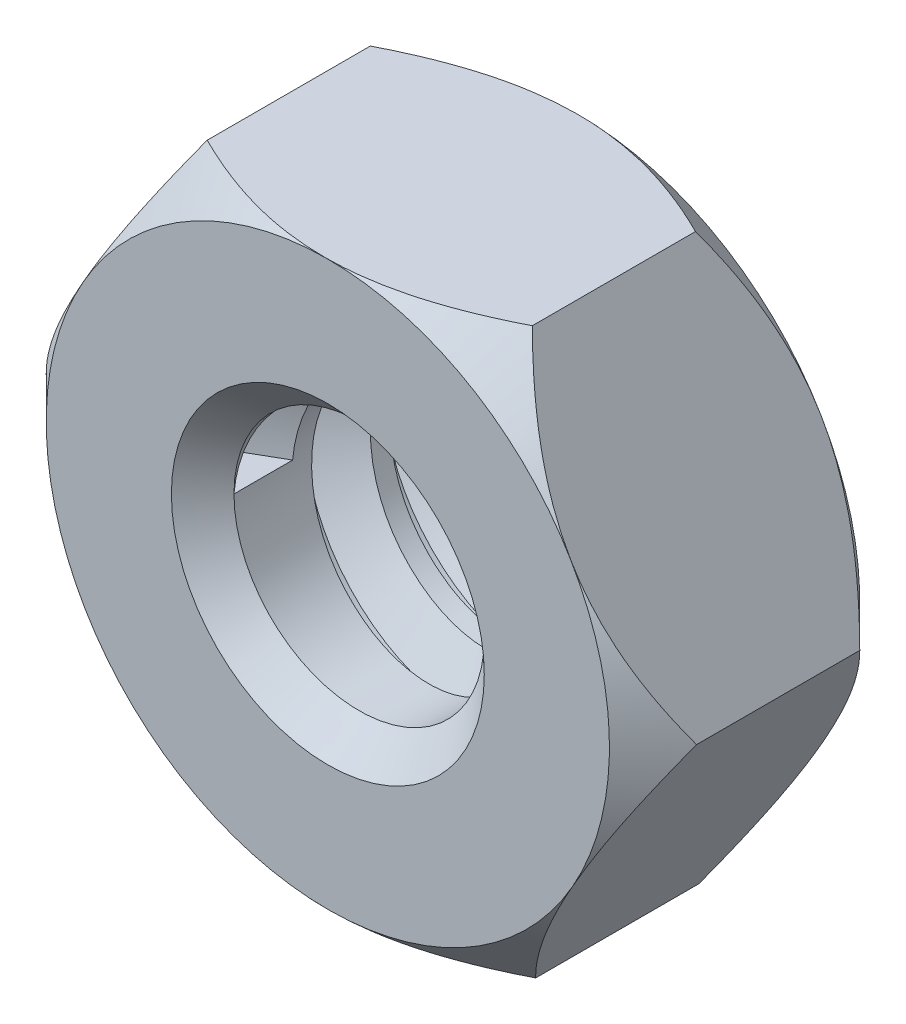
from build123d import *
from build123d.topology import SkipClean

# Parameters (mm, degrees)
BOSS_EXTRUDE2_DEPTH     = 2
SKETCH2_OUTSIDE_W       = 33.182
SKETCH2_OUTSIDE_H       = 31.82
SKETCH2_OUTSIDE_R       = 4.5
CUT_EXTRUDE1_DEPTH      = 8.961609977
CUT_EXTRUDE1_DRAFT      = -45
MIRROR1_COPY_1_SKETCH_W = 33.182
MIRROR1_COPY_1_SKETCH_H = 31.82
MIRROR1_COPY_1_SKETCH_R = 4.5
MIRROR1_COPY_1_DEPTH    = 8.961609977
MIRROR1_COPY_1_DRAFT    = -45
SKETCH3_R               = 2
CUT_EXTRUDE2_DEPTH      = 4
CHAMFER1_SIZE           = 0.5
THREAD2_PITCH           = 1.25


with BuildPart() as part:
    # Sketch1 → Boss-Extrude2 (new, symmetric)
    with BuildSketch(Plane.XY):
        Polygon((2.624715671, -4.484514204), (5.19606106, 0.030813347), (2.571345389, 4.515327551), (-2.624715671, 4.484514204), (-5.19606106, -0.030813347), (-2.571345389, -4.515327551), align=None)
    extrude(amount=BOSS_EXTRUDE2_DEPTH, both=True)


with BuildPart() as cut_extrude1_tool:
    # Sketch2 outside → Cut-Extrude1 (with draft: the straight prism first)
    with BuildSketch(Plane.XY.offset(2)):
        Rectangle(SKETCH2_OUTSIDE_W, SKETCH2_OUTSIDE_H)
        Circle(SKETCH2_OUTSIDE_R, mode=Mode.SUBTRACT)
    extrude(amount=-CUT_EXTRUDE1_DEPTH)
    # Cut-Extrude1: the draft: its side faces are tilted about the plane it starts from
    cut_extrude1_sides = [cut_extrude1_tool.faces().sort_by_distance(p)[0] for p in [
        (0, -15.91, -2.480804989),
        (16.591, 0, -2.480804989),
        (0, 15.91, -2.480804989),
        (-16.591, 0, -2.480804989),
        (-4.5, 0, -2.480804989),
    ]]
    draft(cut_extrude1_sides, Plane.XY.offset(2), CUT_EXTRUDE1_DRAFT)


with BuildPart() as part_1:
    add(part.part)

    # Cut-Extrude1: cut by cut_extrude1_tool
    add(cut_extrude1_tool.part, mode=Mode.SUBTRACT)


with BuildPart() as mirror1_copy_1_tool:
    # Mirror1 copy 1 sketch → Mirror1 copy 1 (with draft: the straight prism first)
    with BuildSketch(Plane(origin=(0, 0, -2), x_dir=(1, 0, 0), z_dir=(0, 0, -1))):
        Rectangle(MIRROR1_COPY_1_SKETCH_W, MIRROR1_COPY_1_SKETCH_H)
        Circle(MIRROR1_COPY_1_SKETCH_R, mode=Mode.SUBTRACT)
    extrude(amount=-MIRROR1_COPY_1_DEPTH)
    # Mirror1 copy 1: the draft: its side faces are tilted about the plane it starts from
    mirror1_copy_1_sides = [mirror1_copy_1_tool.faces().sort_by_distance(p)[0] for p in [
        (0, -15.91, 2.480804989),
        (16.591, 0, 2.480804989),
        (0, 15.91, 2.480804989),
        (-16.591, 0, 2.480804989),
        (-4.5, 0, 2.480804989),
    ]]
    draft(mirror1_copy_1_sides, Plane(origin=(0, 0, -2), x_dir=(1, 0, 0), z_dir=(0, 0, -1)), MIRROR1_COPY_1_DRAFT)


with BuildPart() as part_2:
    add(part_1.part)

    # Mirror1 copy 1: cut by mirror1_copy_1_tool
    add(mirror1_copy_1_tool.part, mode=Mode.SUBTRACT)

    # Sketch3 → Cut-Extrude2 (cut)
    with BuildSketch(Plane.XY.offset(2)):
        Circle(SKETCH3_R)
    extrude(amount=-CUT_EXTRUDE2_DEPTH, mode=Mode.SUBTRACT)

    # Chamfer1
    chamfer1_edges = [part_2.edges().sort_by_distance(p)[0] for p in [
        (-2, 0, -2),
        (-2, 0, 2),
    ]]
    chamfer(chamfer1_edges, length=CHAMFER1_SIZE)

    # Thread2: the profile of Thread Profile2 profile screwed along a right-hand helix of 2.8 turns, 8 arcs to a turn; built about Z, then put on its axis
    with SkipClean():  # the faces are left unmerged after this step: merging them gives an invalid solid
        thread2_z = Axis((0, 0, 0), (0, 0, 1))
        thread2_corners = [(1.9997, 0, -0.000173205), (2.676582344, 0, 0.390624998), (2.676582344, 0, 0.546874998), (1.9997, 0, 0.937673202)]
        with BuildLine(mode=Mode.PRIVATE) as thread2_profile:
            Line(thread2_corners[0], thread2_corners[1])
            Line(thread2_corners[1], thread2_corners[2])
            Line(thread2_corners[2], thread2_corners[3])
            Line(thread2_corners[3], thread2_corners[0])
        thread2_cap = Face(thread2_profile.wire())
        thread2_turn_angles = [0, 22.5, 45, 67.5, 90, 112.5, 135, 157.5, 180, 202.5, 225, 247.5, 270, 292.5, 315, 337.5, 360]
        thread2_turn_weights = [1, 0.9238795325112867, 1, 0.9238795325112867, 1, 0.9238795325112867, 1, 0.9238795325112867, 1, 0.9238795325112867, 1, 0.9238795325112867, 1, 0.9238795325112867, 1, 0.9238795325112867, 1]
        thread2_turn_rails = [Edge.make_bspline([Vector(p[0], p[1], 0).rotate(thread2_z, thread2_turn_angles[k]) / thread2_turn_weights[k] + Vector(0, 0, p[2] + THREAD2_PITCH * thread2_turn_angles[k] / 360) for k in range(17)], [0, 0, 0, 1, 1, 2, 2, 3, 3, 4, 4, 5, 5, 6, 6, 7, 7, 8, 8, 8], 2, thread2_turn_weights) for p in thread2_corners]
        thread2_turn_sides = [Face.make_surface_from_curves(thread2_turn_rails[p[0]], thread2_turn_rails[p[1]]) for p in [(0, 1), (1, 2), (2, 3), (3, 0)]]
        thread2_last_angles = [720, 742.5, 765, 787.5, 810, 832.5, 855, 877.5, 900, 922.5, 945, 967.5, 990, 999, 1008]
        thread2_last_weights = [1, 0.9238795325112867, 1, 0.9238795325112867, 1, 0.9238795325112867, 1, 0.9238795325112867, 1, 0.9238795325112867, 1, 0.9238795325112867, 1, 0.9876883405951372, 1]
        thread2_last_rails = [Edge.make_bspline([Vector(p[0], p[1], 0).rotate(thread2_z, thread2_last_angles[k]) / thread2_last_weights[k] + Vector(0, 0, p[2] + THREAD2_PITCH * thread2_last_angles[k] / 360) for k in range(15)], [0, 0, 0, 1, 1, 2, 2, 3, 3, 4, 4, 5, 5, 6, 6, 7, 7, 7], 2, thread2_last_weights) for p in thread2_corners]
        thread2_last_sides = [Face.make_surface_from_curves(thread2_last_rails[p[0]], thread2_last_rails[p[1]]) for p in [(0, 1), (1, 2), (2, 3), (3, 0)]]
        thread2 = Plane(origin=(0, 0, 1.5), x_dir=(-1, 0, 0), z_dir=(0, 0, -1)) * Solid(Shell([*[p.moved(Location((0, 0, THREAD2_PITCH * i))) for i in range(2) for p in thread2_turn_sides], *thread2_last_sides, thread2_cap, thread2_cap.rotate(thread2_z, 1008).moved(Location((0, 0, THREAD2_PITCH * 1008 / 360)))]))
        add(thread2, mode=Mode.SUBTRACT)


solid = part_2.part
